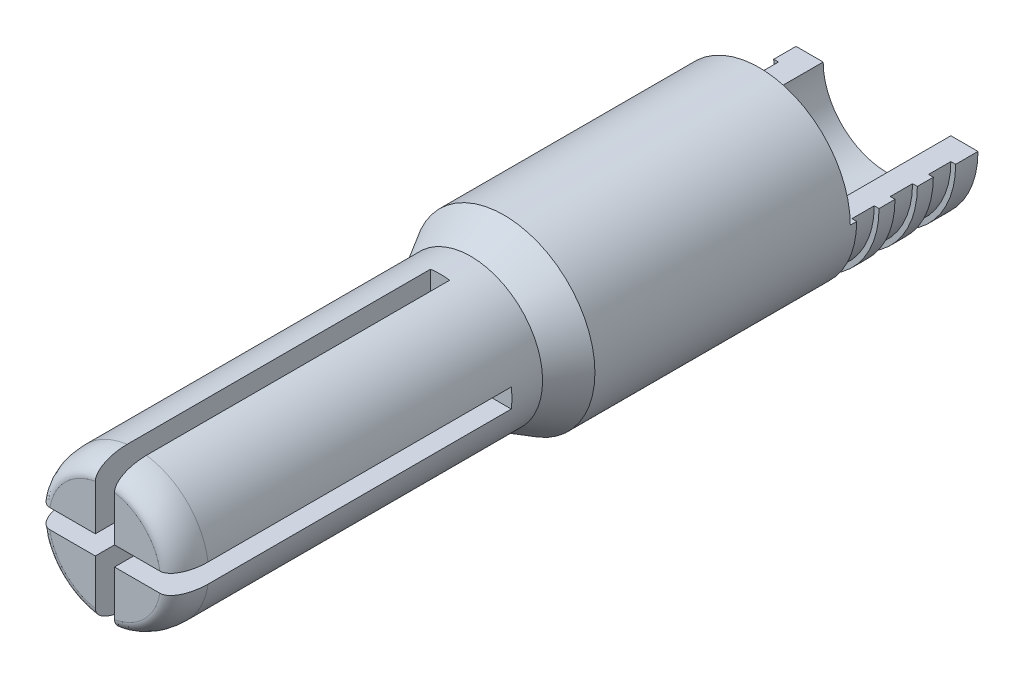
from build123d import *

# Parameters (mm, degrees)
SKETCH_1_R               = 2.85
EXTRUDE_1_DEPTH          = 12
SKETCH_2_R               = 2.25
EXTRUDE_2_DEPTH          = 12.5
SKETCH_3_R               = 2
CUT_EXTRUDE_1_DEPTH      = 12
CHAMFER_1_SIZE           = 1.5
CHAMFER_1_SIZE2          = 0.545955351
CUT_EXTRUDE_2_DEPTH      = 25.829317349
CUT_EXTRUDE_2_DEPTH_BACK = 25.829317349
SKETCH_4_W               = 6.375471686
SKETCH_4_H               = 4.193701662
SKETCH_5_W               = 0.7
SKETCH_5_H               = 0.3
CHAMFER_2_SIZE           = 0.6
CHAMFER_2_SIZE_2         = 1.039230485
SKETCH_6_W               = 0.6
SKETCH_6_H               = 5
SKETCH_6_W_2             = 5
SKETCH_6_H_2             = 0.6
CUT_EXTRUDE_3_DEPTH      = 10.5
FILLET_1_SIZE            = 1
FILLET_1_SIZE_2          = 0.5


with BuildPart() as part:
    # Эскиз1 → Бобышка-Вытянуть1 (new body)
    with BuildSketch(Plane.XY):
        Circle(SKETCH_1_R)
    extrude(amount=EXTRUDE_1_DEPTH)

    # Эскиз2 → Бобышка-Вытянуть2 (add)
    with BuildSketch(Plane.XY.offset(12)):
        Circle(SKETCH_2_R)
    extrude(amount=EXTRUDE_2_DEPTH)

    # Эскиз3 → Вырез-Вытянуть1 (cut)
    with BuildSketch(Plane(origin=(0, 0, 0), x_dir=(-1, 0, 0), z_dir=(0, 0, -1))):
        Circle(SKETCH_3_R)
    extrude(amount=-CUT_EXTRUDE_1_DEPTH, mode=Mode.SUBTRACT)

    # Фаска1
    chamfer_1_edges = [part.edges().sort_by_distance(p)[0] for p in [
        (2, 0, 12),
    ]]
    chamfer_1_side = [part.faces().sort_by_distance(p)[0] for p in [
        (0, 0, 12),
    ]]
    chamfer(chamfer_1_edges, length=CHAMFER_1_SIZE, length2=CHAMFER_1_SIZE2, reference=chamfer_1_side[0])

    # Эскиз4 → Вырез-Вытянуть2 (cut, two sides: drawn at the far end of the back side and taken through both)
    with BuildSketch(Plane(origin=(0, 0, 0), x_dir=(0, 0, -1), z_dir=(1, 0, 0)).offset(-CUT_EXTRUDE_2_DEPTH_BACK)):
        with Locations((-0.812264157, 2.096850831)):
            Rectangle(SKETCH_4_W, SKETCH_4_H)
    extrude(amount=CUT_EXTRUDE_2_DEPTH + CUT_EXTRUDE_2_DEPTH_BACK, mode=Mode.SUBTRACT)

    # Эскиз5 → Вырез-Повернуть1 (revolve, cut)
    with BuildSketch(Plane(origin=(0, 0, 0), x_dir=(0, 0, -1), z_dir=(1, 0, 0))):
        with Locations((-3.45, -2.85)):
            Rectangle(SKETCH_5_W, SKETCH_5_H)
        with Locations((-2.25, -2.85)):
            Rectangle(SKETCH_5_W, SKETCH_5_H)
        with Locations((-1.05, -2.85)):
            Rectangle(SKETCH_5_W, SKETCH_5_H)
    revolve(axis=Axis((0, 0, 0), (0, 0, 1)), mode=Mode.SUBTRACT)

    # Фаска2
    # the kernel refuses this chamfer: 1.039230485, 0.6 mm, written as the material it adds along each edge
    with BuildSketch(Plane(origin=(0, 0, 12), x_dir=(1, 0, 0), z_dir=(0, -1, 0))) as chamfer_2_piece_1_section:
        Polygon((2.25 + CHAMFER_2_SIZE, 0), (2.25, CHAMFER_2_SIZE_2), (2.25, 0), align=None)
    chamfer_2_piece_1 = revolve(axis=Axis((0, 0, 12), (0, 0, 1)), mode=Mode.PRIVATE)
    chamfer_2_piece_1 = chamfer_2_piece_1 & Plane(origin=(0, 0, 12.528833644), x_dir=(1, 0, 0), z_dir=(0, 0, -1)) * Cylinder(2.85, 12, mode=Mode.PRIVATE)
    add(chamfer_2_piece_1)

    # Эскиз6 → Вырез-Вытянуть3 (cut)
    with BuildSketch(Plane.XY.offset(24.5)):
        Rectangle(SKETCH_6_W, SKETCH_6_H)
        Rectangle(SKETCH_6_W_2, SKETCH_6_H_2)
    extrude(amount=-CUT_EXTRUDE_3_DEPTH, mode=Mode.SUBTRACT)

    # Скругление1
    # an asymmetric fillet: 1, 0.5 mm, written as the material it takes off along each edge
    with BuildSketch(Plane(origin=(0, 0, 24.5), x_dir=(0.8292066330076089, 0.5589421792781295, 0), z_dir=(0.5589421792781295, -0.8292066330076089, 0))) as fillet_1_piece_1:
        with BuildLine():
            Bezier((2.25, -FILLET_1_SIZE), (2.25, 0), (2.25 - FILLET_1_SIZE_2, 0), weights=[1, 0.707106781, 1])
            Line((2.25 - FILLET_1_SIZE_2, 0), (2.25, 0))
            Line((2.25, 0), (2.25, -FILLET_1_SIZE))
        make_face()
    revolve(axis=Axis((0, 0, 24.5), (0, 0, 1)), revolution_arc=202.034652165, mode=Mode.SUBTRACT)
    with BuildSketch(Plane(origin=(0, 0, 24.5), x_dir=(-0.5589421792781271, 0.8292066330076105, 0), z_dir=(0.8292066330076105, 0.5589421792781271, 0))) as fillet_1_piece_2:
        with BuildLine():
            Bezier((2.25, -FILLET_1_SIZE), (2.25, 0), (2.25 - FILLET_1_SIZE_2, 0), weights=[1, 0.707106781, 1])
            Line((2.25 - FILLET_1_SIZE_2, 0), (2.25, 0))
            Line((2.25, 0), (2.25, -FILLET_1_SIZE))
        make_face()
    revolve(axis=Axis((0, 0, 24.5), (0, 0, 1)), revolution_arc=202.034652165, mode=Mode.SUBTRACT)
    with BuildSketch(Plane(origin=(0, 0, 24.5), x_dir=(-0.8292066330076107, -0.5589421792781271, 0), z_dir=(-0.5589421792781271, 0.8292066330076107, 0))) as fillet_1_piece_3:
        with BuildLine():
            Bezier((2.25, -FILLET_1_SIZE), (2.25, 0), (2.25 - FILLET_1_SIZE_2, 0), weights=[1, 0.707106781, 1])
            Line((2.25 - FILLET_1_SIZE_2, 0), (2.25, 0))
            Line((2.25, 0), (2.25, -FILLET_1_SIZE))
        make_face()
    revolve(axis=Axis((0, 0, 24.5), (0, 0, 1)), revolution_arc=202.034652165, mode=Mode.SUBTRACT)
    with BuildSketch(Plane(origin=(0, 0, 24.5), x_dir=(0.5589421792781443, -0.8292066330075989, 0), z_dir=(-0.8292066330075989, -0.5589421792781443, 0))) as fillet_1_piece_4:
        with BuildLine():
            Bezier((2.25, -FILLET_1_SIZE), (2.25, 0), (2.25 - FILLET_1_SIZE_2, 0), weights=[1, 0.707106781, 1])
            Line((2.25 - FILLET_1_SIZE_2, 0), (2.25, 0))
            Line((2.25, 0), (2.25, -FILLET_1_SIZE))
        make_face()
    revolve(axis=Axis((0, 0, 24.5), (0, 0, 1)), revolution_arc=202.034652165, mode=Mode.SUBTRACT)


solid = part.part
